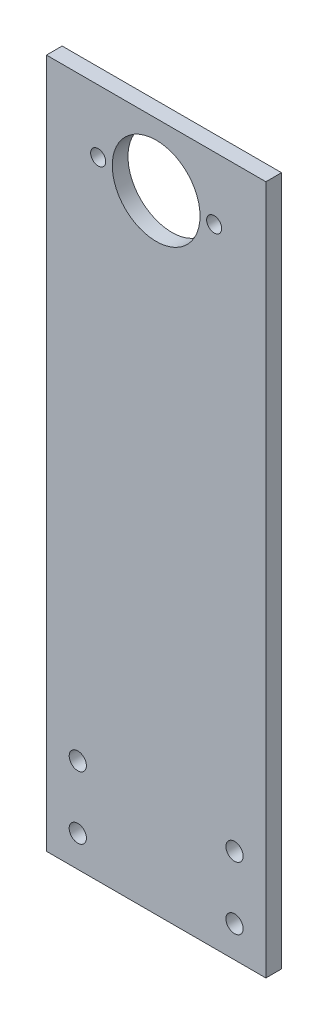
from build123d import *

# Parameters (mm, degrees)
SKETCH1_R           = 2.75
SKETCH1_R_2         = 2.4
SKETCH1_R_3         = 14
BOSS_EXTRUDE1_DEPTH = 5


with BuildPart() as part:
    # Sketch1 → Boss-Extrude1 (new body)
    with BuildSketch(Plane.XY):
        Polygon((-35, 100), (-35, -100), (-35, -120), (35, -120), (35, -100), (35, 100), align=None)
        with Locations((-25, -110)):
            Circle(SKETCH1_R, mode=Mode.SUBTRACT)
        with Locations((-25, -90)):
            Circle(SKETCH1_R, mode=Mode.SUBTRACT)
        with Locations((25, -110)):
            Circle(SKETCH1_R, mode=Mode.SUBTRACT)
        with Locations((25, -90)):
            Circle(SKETCH1_R, mode=Mode.SUBTRACT)
        with Locations((-18.5, 80)):
            Circle(SKETCH1_R_2, mode=Mode.SUBTRACT)
        with Locations((0, 80)):
            Circle(SKETCH1_R_3, mode=Mode.SUBTRACT)
        with Locations((18.5, 80)):
            Circle(SKETCH1_R_2, mode=Mode.SUBTRACT)
    extrude(amount=BOSS_EXTRUDE1_DEPTH)


solid = part.part
